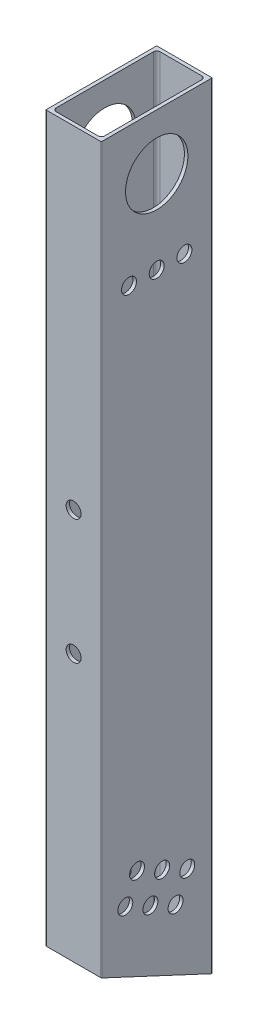
from build123d import *

# Parameters (mm, degrees)
BOSS_EXTRUDE1_DEPTH = 355.6
SKETCH2_R           = 3.429
SKETCH2_R_2         = 14.2875
CUT_EXTRUDE1_DEPTH  = 358.409680899
SKETCH3_R           = 3.429
CUT_EXTRUDE2_DEPTH  = 357.732126392
SKETCH3_3_R         = 9.525
CUT_EXTRUDE3_DEPTH  = 357.732126392


with BuildPart() as part:
    # Sketch1 → Boss-Extrude1 (new body)
    with BuildSketch(Plane(origin=(0, 0, 0), x_dir=(1, 0, 0), z_dir=(0, 1, 0))):
        with BuildLine():
            Line((-12.446, -25.4), (12.446, -25.4))
            ThreePointArc((12.446, -25.4), (12.625605122, -25.325605122), (12.7, -25.146))
            Line((12.7, -25.146), (12.7, 25.146))
            ThreePointArc((12.7, 25.146), (12.625605122, 25.325605122), (12.446, 25.4))
            Line((12.446, 25.4), (-12.446, 25.4))
            ThreePointArc((-12.446, 25.4), (-12.625605122, 25.325605122), (-12.7, 25.146))
            Line((-12.7, 25.146), (-12.7, -25.146))
            ThreePointArc((-12.7, -25.146), (-12.625605122, -25.325605122), (-12.446, -25.4))
        make_face()
        with BuildLine():
            Line((-9.5885, 23.8125), (9.5885, 23.8125))
            ThreePointArc((9.5885, 23.8125), (10.666130735, 23.366130735), (11.1125, 22.2885))
            Line((11.1125, 22.2885), (11.1125, -22.2885))
            ThreePointArc((11.1125, -22.2885), (10.666130735, -23.366130735), (9.5885, -23.8125))
            Line((9.5885, -23.8125), (-9.5885, -23.8125))
            ThreePointArc((-9.5885, -23.8125), (-10.666130735, -23.366130735), (-11.1125, -22.2885))
            Line((-11.1125, -22.2885), (-11.1125, 22.2885))
            ThreePointArc((-11.1125, 22.2885), (-10.666130735, 23.366130735), (-9.5885, 23.8125))
        make_face(mode=Mode.SUBTRACT)
    extrude(amount=BOSS_EXTRUDE1_DEPTH)

    # Sketch2 → Cut-Extrude1 (cut, through all)
    with BuildSketch(Plane.ZY.offset(12.7)):
        with Locations((-8.632581672, 35.844574716)):
            Circle(SKETCH2_R)
        with Locations((0, 330.2)):
            Circle(SKETCH2_R_2)
        with Locations((0, 292.1)):
            Circle(SKETCH2_R)
        with Locations((12.7, 292.1)):
            Circle(SKETCH2_R)
        with Locations((-12.7, 292.1)):
            Circle(SKETCH2_R)
        with Locations((2.877527224, 41.21182664)):
            Circle(SKETCH2_R)
        with Locations((14.387636119, 46.579078564)):
            Circle(SKETCH2_R)
        with Locations((-2.4897247, 52.721935535)):
            Circle(SKETCH2_R)
        with Locations((9.020384195, 58.089187459)):
            Circle(SKETCH2_R)
        with Locations((-13.999833596, 47.354683611)):
            Circle(SKETCH2_R)
        Polygon((-25.4, 0), (25.4, 23.688429034), (25.4, 0), align=None)
    extrude(amount=-CUT_EXTRUDE1_DEPTH, mode=Mode.SUBTRACT)

    # Sketch3 → Cut-Extrude2 (cut, through all)
    with BuildSketch(Plane.XY):
        with Locations((0, 203.2)):
            Circle(SKETCH3_R)
        with Locations((0, 146.05)):
            Circle(SKETCH3_R)
    extrude(amount=CUT_EXTRUDE2_DEPTH, mode=Mode.SUBTRACT)

    # Sketch3<3> → Cut-Extrude3 (cut, through all)
    with BuildSketch(Plane.XY):
        with Locations((0, 203.2)):
            Circle(SKETCH3_3_R)
        with Locations((0, 146.05)):
            Circle(SKETCH3_3_R)
    extrude(amount=-CUT_EXTRUDE3_DEPTH, mode=Mode.SUBTRACT)


solid = part.part
